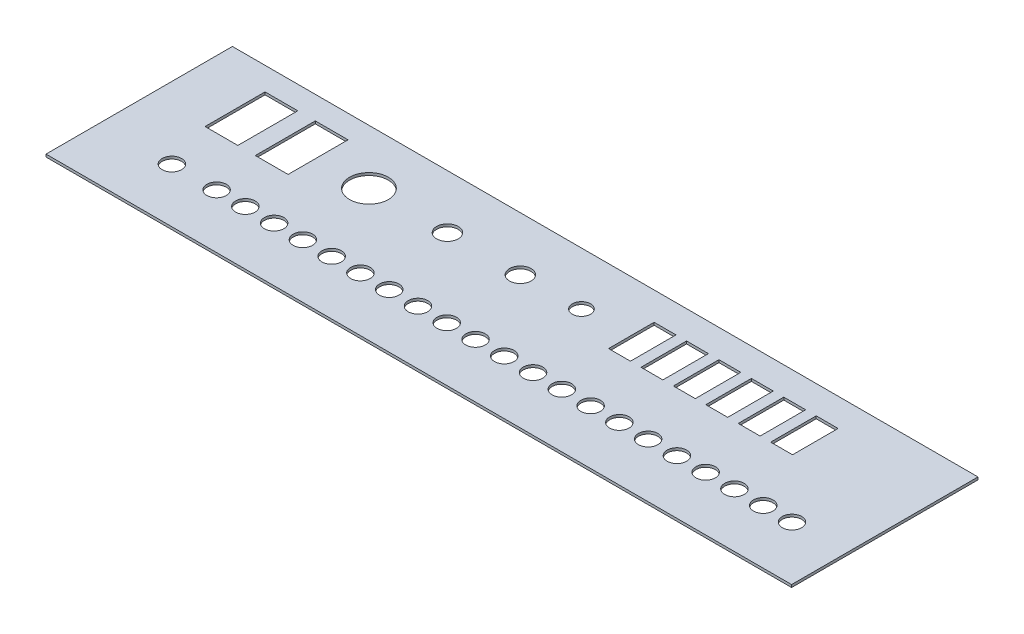
from build123d import *

# Parameters (mm, degrees)
SKETCH4_R           = 11.95
SKETCH4_R_2         = 6.65
SKETCH4_R_3         = 5.6
SKETCH4_R_4         = 6
SKETCH4_W           = 20.218579234
SKETCH4_H           = 37
SKETCH4_W_2         = 13.5
SKETCH4_H_2         = 28.1
BOSS_EXTRUDE1_DEPTH = 1.6


with BuildPart() as part:
    # Sketch4 → Boss-Extrude1 (new body)
    with BuildSketch(Plane(origin=(0, 0, 0), x_dir=(1, 0, 0), z_dir=(0, 1, 0))):
        Polygon((-60.547420146, 63.390203379), (394.452579854, 63.390203379), (396.952579854, 63.390203379), (396.952579854, -51.609796621), (394.452579854, -51.609796621), (-60.547420146, -51.609796621), (-63.047420146, -51.609796621), (-63.047420146, 63.390203379), align=None)
        with Locations((54.9, 29.690203379)):
            Circle(SKETCH4_R, mode=Mode.SUBTRACT)
        with Locations((102.75, 30.240203379)):
            Circle(SKETCH4_R_2, mode=Mode.SUBTRACT)
        with Locations((147.75, 30.240203379)):
            Circle(SKETCH4_R_2, mode=Mode.SUBTRACT)
        with Locations((184.9, 30.790203379)):
            Circle(SKETCH4_R_3, mode=Mode.SUBTRACT)
        with Locations((-18.9, -18.109796621)):
            Circle(SKETCH4_R_4, mode=Mode.SUBTRACT)
        with Locations((8.7, -18.109796621)):
            Circle(SKETCH4_R_4, mode=Mode.SUBTRACT)
        with Locations((26.45, -18.109796621)):
            Circle(SKETCH4_R_4, mode=Mode.SUBTRACT)
        with Locations((44.2, -18.109796621)):
            Circle(SKETCH4_R_4, mode=Mode.SUBTRACT)
        with Locations((61.95, -18.109796621)):
            Circle(SKETCH4_R_4, mode=Mode.SUBTRACT)
        with Locations((79.7, -18.109796621)):
            Circle(SKETCH4_R_4, mode=Mode.SUBTRACT)
        with Locations((97.45, -18.109796621)):
            Circle(SKETCH4_R_4, mode=Mode.SUBTRACT)
        with Locations((115.2, -18.109796621)):
            Circle(SKETCH4_R_4, mode=Mode.SUBTRACT)
        with Locations((132.95, -18.109796621)):
            Circle(SKETCH4_R_4, mode=Mode.SUBTRACT)
        with Locations((150.7, -18.109796621)):
            Circle(SKETCH4_R_4, mode=Mode.SUBTRACT)
        with Locations((168.45, -18.109796621)):
            Circle(SKETCH4_R_4, mode=Mode.SUBTRACT)
        with Locations((186.2, -18.109796621)):
            Circle(SKETCH4_R_4, mode=Mode.SUBTRACT)
        with Locations((203.95, -18.109796621)):
            Circle(SKETCH4_R_4, mode=Mode.SUBTRACT)
        with Locations((221.7, -18.109796621)):
            Circle(SKETCH4_R_4, mode=Mode.SUBTRACT)
        with Locations((239.45, -18.109796621)):
            Circle(SKETCH4_R_4, mode=Mode.SUBTRACT)
        with Locations((257.2, -18.109796621)):
            Circle(SKETCH4_R_4, mode=Mode.SUBTRACT)
        with Locations((274.95, -18.109796621)):
            Circle(SKETCH4_R_4, mode=Mode.SUBTRACT)
        with Locations((292.7, -18.109796621)):
            Circle(SKETCH4_R_4, mode=Mode.SUBTRACT)
        with Locations((310.45, -18.109796621)):
            Circle(SKETCH4_R_4, mode=Mode.SUBTRACT)
        with Locations((328.2, -18.109796621)):
            Circle(SKETCH4_R_4, mode=Mode.SUBTRACT)
        with Locations((345.95, -18.109796621)):
            Circle(SKETCH4_R_4, mode=Mode.SUBTRACT)
        with Locations((363.7, -18.109796621)):
            Circle(SKETCH4_R_4, mode=Mode.SUBTRACT)
        with Locations((-18.6, 30.690203379)):
            Rectangle(SKETCH4_W, SKETCH4_H, mode=Mode.SUBTRACT)
        with Locations((12.4, 30.690203379)):
            Rectangle(SKETCH4_W, SKETCH4_H, mode=Mode.SUBTRACT)
        with Locations((241.15, 32.073143277)):
            Rectangle(SKETCH4_W_2, SKETCH4_H_2, mode=Mode.SUBTRACT)
        with Locations((221.15, 32.073143277)):
            Rectangle(SKETCH4_W_2, SKETCH4_H_2, mode=Mode.SUBTRACT)
        with Locations((261.15, 32.073143277)):
            Rectangle(SKETCH4_W_2, SKETCH4_H_2, mode=Mode.SUBTRACT)
        with Locations((281.15, 32.073143277)):
            Rectangle(SKETCH4_W_2, SKETCH4_H_2, mode=Mode.SUBTRACT)
        with Locations((301.15, 32.073143277)):
            Rectangle(SKETCH4_W_2, SKETCH4_H_2, mode=Mode.SUBTRACT)
        with Locations((321.15, 32.073143277)):
            Rectangle(SKETCH4_W_2, SKETCH4_H_2, mode=Mode.SUBTRACT)
    extrude(amount=BOSS_EXTRUDE1_DEPTH)


solid = part.part
